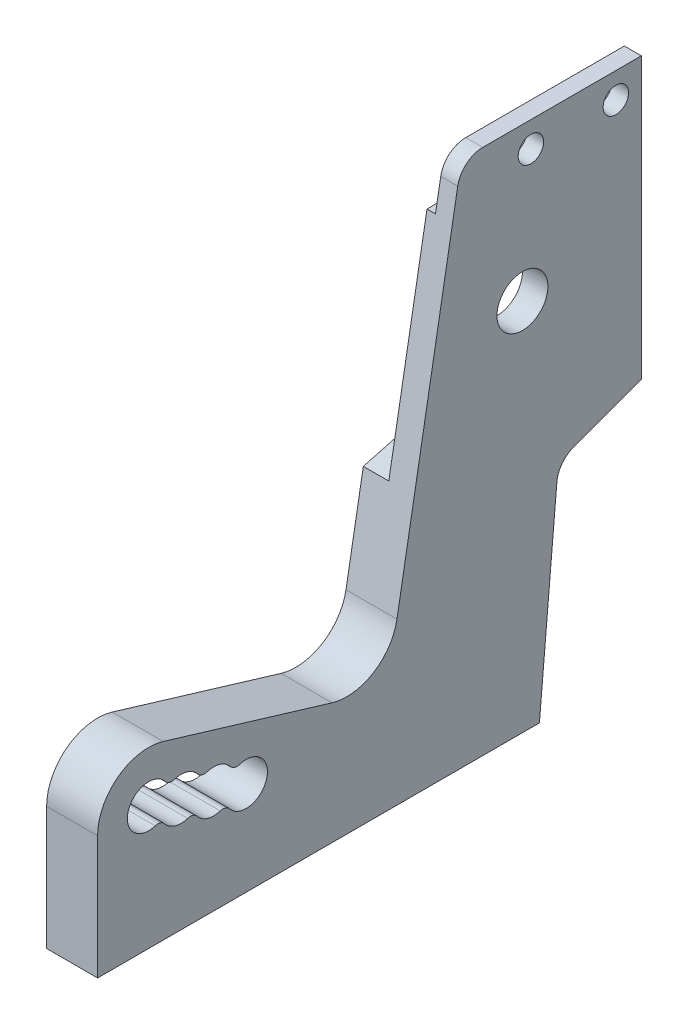
from build123d import *

# Parameters (mm, degrees)
SKETCH1_W                   = 64
SKETCH1_H                   = 62
SKETCH1_R                   = 2.5
SKETCH1_R_2                 = 3
BOSS_EXTRUDE1_DEPTH         = 6
CUT_EXTRUDE1_REACH          = 91.308
CUT_EXTRUDE2_REACH          = 91.308
FILLET1_R                   = 3
FILLET2_R                   = 3
TAP_DRILL_FOR_M3_TAP1_D     = 2.5
TAP_DRILL_FOR_M3_TAP1_DEPTH = 9
TAP_DRILL_FOR_M3_TAP1_TIP   = 0.751075774
CUT_EXTRUDE3_DEPTH          = 3
CUT_EXTRUDE4_REACH          = 91.157
SKETCH10_R                  = 1.5
CUT_EXTRUDE5_REACH          = 91.308
SKETCH11_R                  = 2.5
LPATTERN1_COUNT             = 3
LPATTERN1_PITCH             = 4
FILLET3_R                   = 1
SKETCH12_W                  = 22.982575198
SKETCH12_H                  = 6
CUT_EXTRUDE6_DEPTH          = 1


with BuildPart() as part:
    # Sketch1 → Boss-Extrude1 (new body)
    with BuildSketch(Plane(origin=(0, 0, 0), x_dir=(0, 0, -1), z_dir=(1, 0, 0))):
        with Locations((32, 31)):
            Rectangle(SKETCH1_W, SKETCH1_H)
        with Locations((6, 14.5)):
            Circle(SKETCH1_R, mode=Mode.SUBTRACT)
        with Locations((50, 44)):
            Circle(SKETCH1_R_2, mode=Mode.SUBTRACT)
    extrude(amount=BOSS_EXTRUDE1_DEPTH)

    # Sketch2 → Cut-Extrude1 (cut, up to next)
    with BuildSketch(Plane(origin=(6, 0, 0), x_dir=(0, 0, -1), z_dir=(1, 0, 0)), mode=Mode.PRIVATE) as cut_extrude1_sk1:
        with BuildLine():
            Line((7.732242893, 20.244504727), (27.593137265, 14.255495273))
            ThreePointArc((27.593137265, 14.255495273), (32.470162023, 14.890171527), (35.234226676, 18.958110934))
            Line((35.234226676, 18.958110934), (43, 63))
            Line((43, 63), (0, 63))
            Line((0, 63), (0, 14.5))
            ThreePointArc((0, 14.5), (2.421834084, 19.316298234), (7.732242893, 20.244504727))
        make_face()
    cut_extrude1_tool1 = extrude(cut_extrude1_sk1.sketch, amount=-CUT_EXTRUDE1_REACH, mode=Mode.PRIVATE) & part.part
    add(cut_extrude1_tool1.solids().sort_by_distance((6, 40.863189, -19.912877))[0], mode=Mode.SUBTRACT)

    # Sketch3 → Cut-Extrude2 (cut, up to next)
    with BuildSketch(Plane(origin=(6, 0, 0), x_dir=(0, 0, -1), z_dir=(1, 0, 0)), mode=Mode.PRIVATE) as cut_extrude2_sk1:
        Polygon((64, 0), (52, 0), (54.225932994, 25.442530542), (64, 29), align=None)
    cut_extrude2_tool1 = extrude(cut_extrude2_sk1.sketch, amount=-CUT_EXTRUDE2_REACH, mode=Mode.PRIVATE) & part.part
    add(cut_extrude2_tool1.solids().sort_by_distance((6, 13.1347, -58.667711))[0], mode=Mode.SUBTRACT)

    # Fillet1
    fillet1_edges = [part.edges().sort_by_distance(p)[0] for p in [
        (3, 62, -42.823673019),
    ]]
    fillet(fillet1_edges, radius=FILLET1_R)

    # Fillet2
    fillet2_edges = [part.edges().sort_by_distance(p)[0] for p in [
        (3, 25.442530542, -54.225932994),
    ]]
    fillet(fillet2_edges, radius=FILLET2_R)

    # Tap Drill for M3 Tap1
    with Locations(Plane(origin=(0, 0, 0), x_dir=(-1, 0, 0), z_dir=(0, -1, 0))):
        with Locations((-3, 46), (-3, 10)):
            Hole(TAP_DRILL_FOR_M3_TAP1_D / 2, depth=TAP_DRILL_FOR_M3_TAP1_DEPTH)
            with Locations((0, 0, -(TAP_DRILL_FOR_M3_TAP1_DEPTH + TAP_DRILL_FOR_M3_TAP1_TIP / 2))):  # 118° drill point
                Cone(0, TAP_DRILL_FOR_M3_TAP1_D / 2, TAP_DRILL_FOR_M3_TAP1_TIP, mode=Mode.SUBTRACT)

    # Sketch9 → Cut-Extrude3 (cut)
    with BuildSketch(Plane.ZY):
        Polygon((-64, 62), (-64, 35), (-54, 35), (-37.272527114, 30.517887149), (-42.823673019, 62), align=None)
    extrude(amount=-CUT_EXTRUDE3_DEPTH, mode=Mode.SUBTRACT)

    # Sketch10 → Cut-Extrude4 (cut, up to next)
    with BuildSketch(Plane.ZY.offset(-3), mode=Mode.PRIVATE) as cut_extrude4_sk1:
        with Locations((-61, 59)):
            Circle(SKETCH10_R)
    cut_extrude4_tool1 = extrude(cut_extrude4_sk1.sketch, amount=-CUT_EXTRUDE4_REACH, mode=Mode.PRIVATE) & part.part
    # Sketch10 → Cut-Extrude4 (cut, up to next)
    with BuildSketch(Plane.ZY.offset(-3), mode=Mode.PRIVATE) as cut_extrude4_sk2:
        with Locations((-51, 59)):
            Circle(SKETCH10_R)
    cut_extrude4_tool2 = extrude(cut_extrude4_sk2.sketch, amount=-CUT_EXTRUDE4_REACH, mode=Mode.PRIVATE) & part.part
    add(cut_extrude4_tool1.solids().sort_by_distance((3, 59, -61))[0], mode=Mode.SUBTRACT)
    add(cut_extrude4_tool2.solids().sort_by_distance((3, 59, -51))[0], mode=Mode.SUBTRACT)

    # Sketch11 → Cut-Extrude5 (cut, up to next)
    with BuildSketch(Plane.ZY, mode=Mode.PRIVATE) as cut_extrude5_sk1:
        with Locations((-9.829669818, 13.345171405)):
            Circle(SKETCH11_R)
    cut_extrude5_tool1 = extrude(cut_extrude5_sk1.sketch, amount=-CUT_EXTRUDE5_REACH, mode=Mode.PRIVATE) & part.part
    cut_extrude5 = cut_extrude5_tool1.solids().sort_by_distance((0, 13.345171, -9.82967))[0]
    add(cut_extrude5, mode=Mode.SUBTRACT)

    # LPattern1: Cut-Extrude5 ×3
    with Locations(*[Vector(0, -0.2887071487976333, -0.9574174545270947) * (i * LPATTERN1_PITCH) for i in range(1, LPATTERN1_COUNT)]):
        add(cut_extrude5, mode=Mode.SUBTRACT)

    # Fillet3
    fillet3_edges = [part.edges().sort_by_distance(p)[0] for p in [
        (3, 12.486459521, -7.481774186),
        (3, 11.331630925, -11.311444004),
        (3, 10.17680233, -15.141113822),
        (3, 15.358711884, -8.347895632),
        (3, 14.203883289, -12.17756545),
        (3, 13.049054694, -16.007235268),
    ]]
    fillet(fillet3_edges, radius=FILLET3_R)

    # Sketch12 → Cut-Extrude6 (cut)
    with BuildSketch(Plane.ZY.offset(-3)):
        with Locations((-52.508712401, 59)):
            Rectangle(SKETCH12_W, SKETCH12_H)
    extrude(amount=-CUT_EXTRUDE6_DEPTH, mode=Mode.SUBTRACT)


solid = part.part
